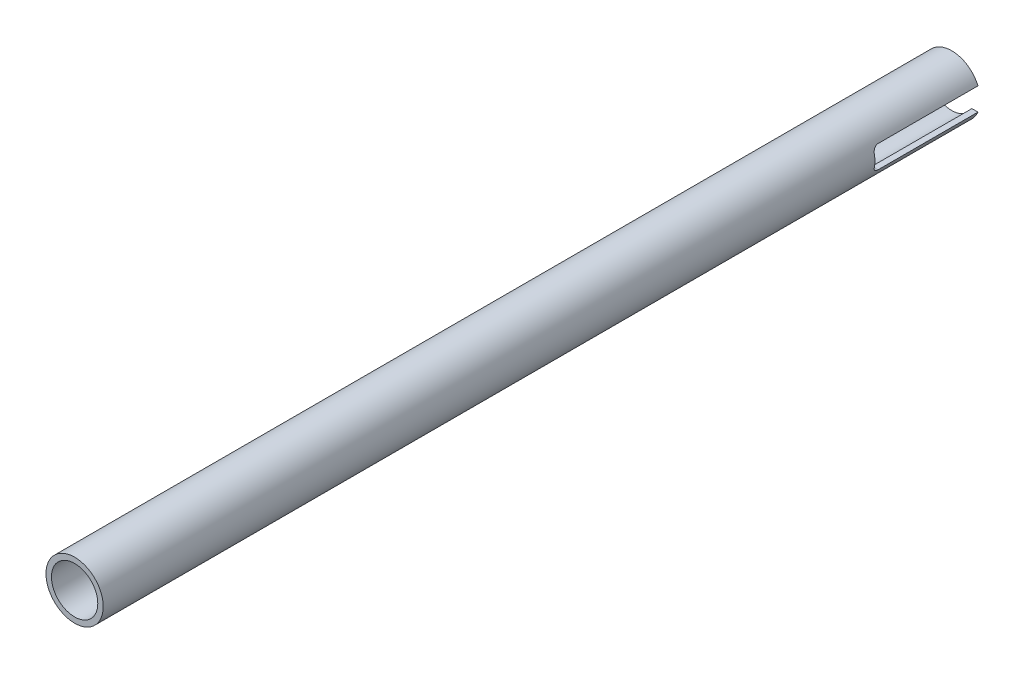
from build123d import *

# Parameters (mm, degrees)
SKETCH1_R               = 8.001
SKETCH1_R_2             = 6.477
BOSS_EXTRUDE1_DEPTH     = 245.11
CUT_EXTRUDE1_DEPTH      = 246.371033543
CUT_EXTRUDE1_DEPTH_BACK = 246.371033543


with BuildPart() as part:
    # Sketch1 → Boss-Extrude1 (new body)
    with BuildSketch(Plane.XY):
        Circle(SKETCH1_R)
        Circle(SKETCH1_R_2, mode=Mode.SUBTRACT)
    extrude(amount=BOSS_EXTRUDE1_DEPTH)

    # Sketch2 → Cut-Extrude1 (cut, two sides: drawn at the far end of the back side and taken through both)
    with BuildSketch(Plane(origin=(0, 0, 0), x_dir=(0, 0, -1), z_dir=(1, 0, 0)).offset(-CUT_EXTRUDE1_DEPTH_BACK)):
        with BuildLine():
            Line((500.729314698, 3.175), (0, 3.175))
            Line((0, 3.175), (-27.94, 3.175))
            ThreePointArc((-27.94, 3.175), (-29.017630735, 2.728630735), (-29.464, 1.651))
            Line((-29.464, 1.651), (-29.464, -1.651))
            ThreePointArc((-29.464, -1.651), (-29.017630735, -2.728630735), (-27.94, -3.175))
            Line((-27.94, -3.175), (0, -3.175))
            Line((0, -3.175), (500.729314698, -3.175))
            Line((500.729314698, -3.175), (1502.187944094, -3.175))
            Line((1502.187944094, -3.175), (1502.187944094, 3.175))
            Line((1502.187944094, 3.175), (500.729314698, 3.175))
        make_face()
    extrude(amount=CUT_EXTRUDE1_DEPTH + CUT_EXTRUDE1_DEPTH_BACK, mode=Mode.SUBTRACT)


solid = part.part
